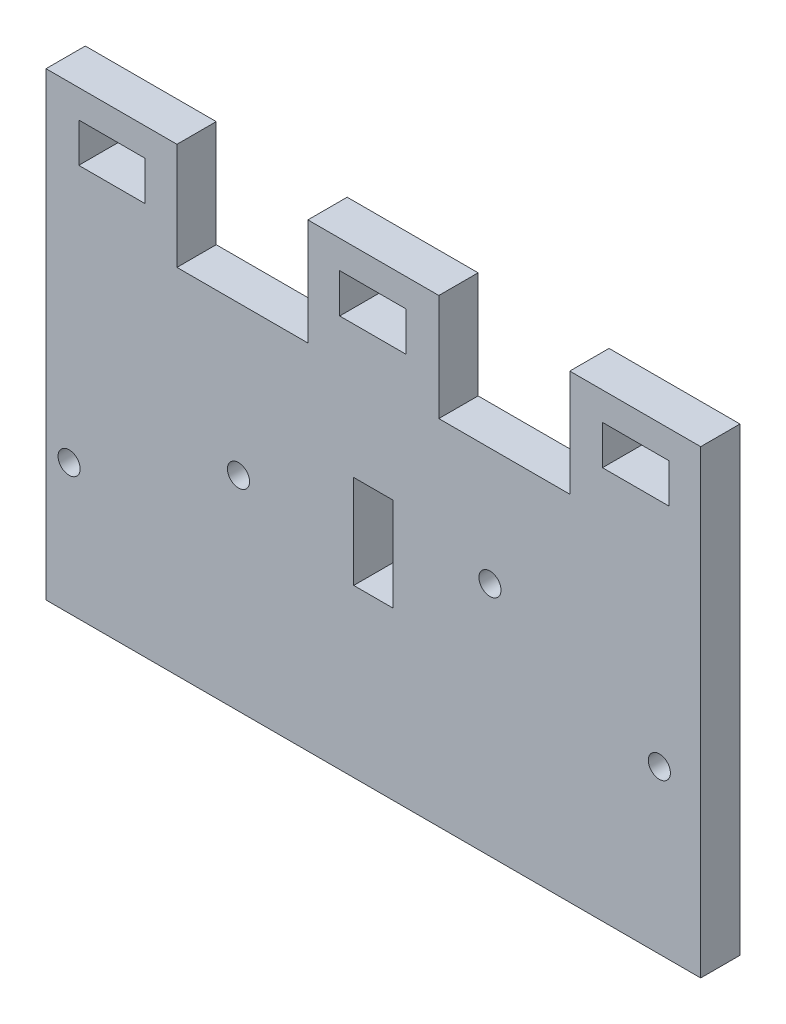
from build123d import *

# Parameters (mm, degrees)
SKETCH1_W           = 88.9
SKETCH1_H           = 62.484
BOSS_EXTRUDE1_DEPTH = 5.334
SKETCH2_W           = 17.78
SKETCH2_H           = 14.478
CUT_EXTRUDE1_DEPTH  = 70.229357574
SKETCH3_W           = 9.017
SKETCH3_H           = 5.334
CUT_EXTRUDE2_DEPTH  = 70.229357574
SKETCH5_W           = 5.334
SKETCH5_H           = 12.7
CUT_EXTRUDE3_DEPTH  = 70.229357574
SKETCH7_R           = 1.5
CUT_EXTRUDE4_DEPTH  = 70.229357574


with BuildPart() as part:
    # Sketch1 → Boss-Extrude1 (new body)
    with BuildSketch(Plane.XY):
        with Locations((5.089694656, -16.821198473)):
            Rectangle(SKETCH1_W, SKETCH1_H)
    extrude(amount=BOSS_EXTRUDE1_DEPTH)

    # Sketch2 → Cut-Extrude1 (cut, through all)
    with BuildSketch(Plane.XY.offset(5.334)):
        with Locations((-12.690305344, 7.181801527)):
            Rectangle(SKETCH2_W, SKETCH2_H)
        with Locations((22.869694656, 7.181801527)):
            Rectangle(SKETCH2_W, SKETCH2_H)
    extrude(amount=-CUT_EXTRUDE1_DEPTH, mode=Mode.SUBTRACT)

    # Sketch3 → Cut-Extrude2 (cut, through all)
    with BuildSketch(Plane.XY.offset(5.334)):
        with Locations((-30.406805344, 7.943801527)):
            Rectangle(SKETCH3_W, SKETCH3_H)
        with Locations((5.026194656, 7.943801527)):
            Rectangle(SKETCH3_W, SKETCH3_H)
        with Locations((40.713194656, 7.943801527)):
            Rectangle(SKETCH3_W, SKETCH3_H)
    extrude(amount=-CUT_EXTRUDE2_DEPTH, mode=Mode.SUBTRACT)

    # Sketch5 → Cut-Extrude3 (cut, through all)
    with BuildSketch(Plane.XY.offset(5.334)):
        with Locations((5.089694656, -19.107198473)):
            Rectangle(SKETCH5_W, SKETCH5_H)
    extrude(amount=-CUT_EXTRUDE3_DEPTH, mode=Mode.SUBTRACT)

    # Sketch7 → Cut-Extrude4 (cut, through all)
    with BuildSketch(Plane.XY.offset(5.334)):
        with Locations((-36.225305344, -30.329198473)):
            Circle(SKETCH7_R)
        with Locations((-13.225305344, -20.329198473)):
            Circle(SKETCH7_R)
        with Locations((20.924694656, -16.011198473)):
            Circle(SKETCH7_R)
        with Locations((43.924694656, -26.011198473)):
            Circle(SKETCH7_R)
    extrude(amount=-CUT_EXTRUDE4_DEPTH, mode=Mode.SUBTRACT)


solid = part.part
